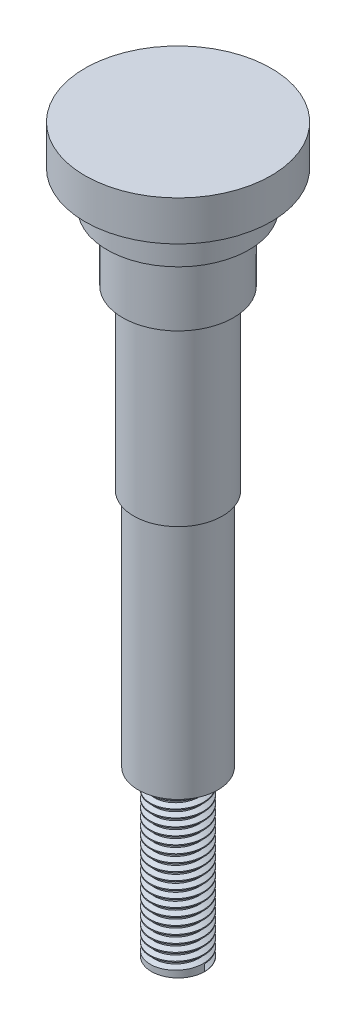
from build123d import *

# Parameters (mm, degrees)
SKETCH2_R           = 21
BOSS_EXTRUDE1_DEPTH = 9
SKETCH3_R           = 16
BOSS_EXTRUDE2_DEPTH = 8
SKETCH4_R           = 12.5
BOSS_EXTRUDE3_DEPTH = 15
SKETCH5_R           = 10
BOSS_EXTRUDE4_DEPTH = 40
SKETCH6_R           = 9
BOSS_EXTRUDE5_DEPTH = 54
SKETCH7_R           = 6
BOSS_EXTRUDE6_DEPTH = 37
THREAD1_PITCH       = 1.75


with BuildPart() as part:
    # Sketch2 → Boss-Extrude1 (new body)
    with BuildSketch(Plane(origin=(0, 0, 0), x_dir=(1, 0, 0), z_dir=(0, 1, 0))):
        with Locations(Location((0, 0, 0), (0, 0, 270))):
            Circle(SKETCH2_R)
    extrude(amount=BOSS_EXTRUDE1_DEPTH)

    # Sketch3 → Boss-Extrude2 (add)
    with BuildSketch(Plane.XZ):
        with Locations(Location((0, 0, 0), (0, 0, 270))):
            Circle(SKETCH3_R)
    extrude(amount=BOSS_EXTRUDE2_DEPTH)

    # Sketch4 → Boss-Extrude3 (add)
    with BuildSketch(Plane.XZ.offset(8)):
        with Locations(Location((0, 0, 0), (0, 0, 270))):
            Circle(SKETCH4_R)
    extrude(amount=BOSS_EXTRUDE3_DEPTH)

    # Sketch5 → Boss-Extrude4 (add)
    with BuildSketch(Plane.XZ.offset(23)):
        with Locations(Location((0, 0, 0), (0, 0, 270))):
            Circle(SKETCH5_R)
    extrude(amount=BOSS_EXTRUDE4_DEPTH)

    # Sketch6 → Boss-Extrude5 (add)
    with BuildSketch(Plane.XZ.offset(63)):
        with Locations(Location((0, 0, 0), (0, 0, 270))):
            Circle(SKETCH6_R)
    extrude(amount=BOSS_EXTRUDE5_DEPTH)

    # Sketch7 → Boss-Extrude6 (add)
    with BuildSketch(Plane.XZ.offset(117)):
        with Locations(Location((0, 0, 0), (0, 0, 270))):
            Circle(SKETCH7_R)
    extrude(amount=BOSS_EXTRUDE6_DEPTH)

    # Thread1: the profile of Thread Profile1 profile screwed along a right-hand helix of 21.142857 turns, 10 arcs to a turn; built about Z, then put on its axis
    thread1_z = Axis((0, 0, 0), (0, 0, 1))
    thread1_corners = [(6.0003, 0, -0.000173205), (6.0003, 0, 1.5314232), (5.052784719, 0, 0.984374998), (5.052784719, 0, 0.546874998)]
    with BuildLine(mode=Mode.PRIVATE) as thread1_profile:
        Line(thread1_corners[0], thread1_corners[1])
        Line(thread1_corners[1], thread1_corners[2])
        Line(thread1_corners[2], thread1_corners[3])
        Line(thread1_corners[3], thread1_corners[0])
    thread1_cap = Face(thread1_profile.wire())
    thread1_turn_angles = [0, 18, 36, 54, 72, 90, 108, 126, 144, 162, 180, 198, 216, 234, 252, 270, 288, 306, 324, 342, 360]
    thread1_turn_weights = [1, 0.9510565162951535, 1, 0.9510565162951535, 1, 0.9510565162951535, 1, 0.9510565162951535, 1, 0.9510565162951535, 1, 0.9510565162951535, 1, 0.9510565162951535, 1, 0.9510565162951535, 1, 0.9510565162951535, 1, 0.9510565162951535, 1]
    thread1_turn_rails = [Edge.make_bspline([Vector(p[0], p[1], 0).rotate(thread1_z, thread1_turn_angles[k]) / thread1_turn_weights[k] + Vector(0, 0, p[2] + THREAD1_PITCH * thread1_turn_angles[k] / 360) for k in range(21)], [0, 0, 0, 1, 1, 2, 2, 3, 3, 4, 4, 5, 5, 6, 6, 7, 7, 8, 8, 9, 9, 10, 10, 10], 2, thread1_turn_weights) for p in thread1_corners]
    thread1_turn_sides = [Face.make_surface_from_curves(thread1_turn_rails[p[0]], thread1_turn_rails[p[1]]) for p in [(0, 1), (1, 2), (2, 3), (3, 0)]]
    thread1_last_angles = [7560, 7578, 7596, 7603.714285714, 7611.428571429]
    thread1_last_weights = [1, 0.9510565162951535, 1, 0.9909497617679336, 1]
    thread1_last_rails = [Edge.make_bspline([Vector(p[0], p[1], 0).rotate(thread1_z, thread1_last_angles[k]) / thread1_last_weights[k] + Vector(0, 0, p[2] + THREAD1_PITCH * thread1_last_angles[k] / 360) for k in range(5)], [0, 0, 0, 1, 1, 2, 2, 2], 2, thread1_last_weights) for p in thread1_corners]
    thread1_last_sides = [Face.make_surface_from_curves(thread1_last_rails[p[0]], thread1_last_rails[p[1]]) for p in [(0, 1), (1, 2), (2, 3), (3, 0)]]
    thread1 = Plane(origin=(0, -154, 0), x_dir=(1, 0, 0), z_dir=(0, 1, 0)) * Solid(Shell([*[p.moved(Location((0, 0, THREAD1_PITCH * i))) for i in range(21) for p in thread1_turn_sides], *thread1_last_sides, thread1_cap, thread1_cap.rotate(thread1_z, 7611.428571429).moved(Location((0, 0, THREAD1_PITCH * 7611.428571429 / 360)))]))
    add(thread1, mode=Mode.SUBTRACT)


solid = part.part
